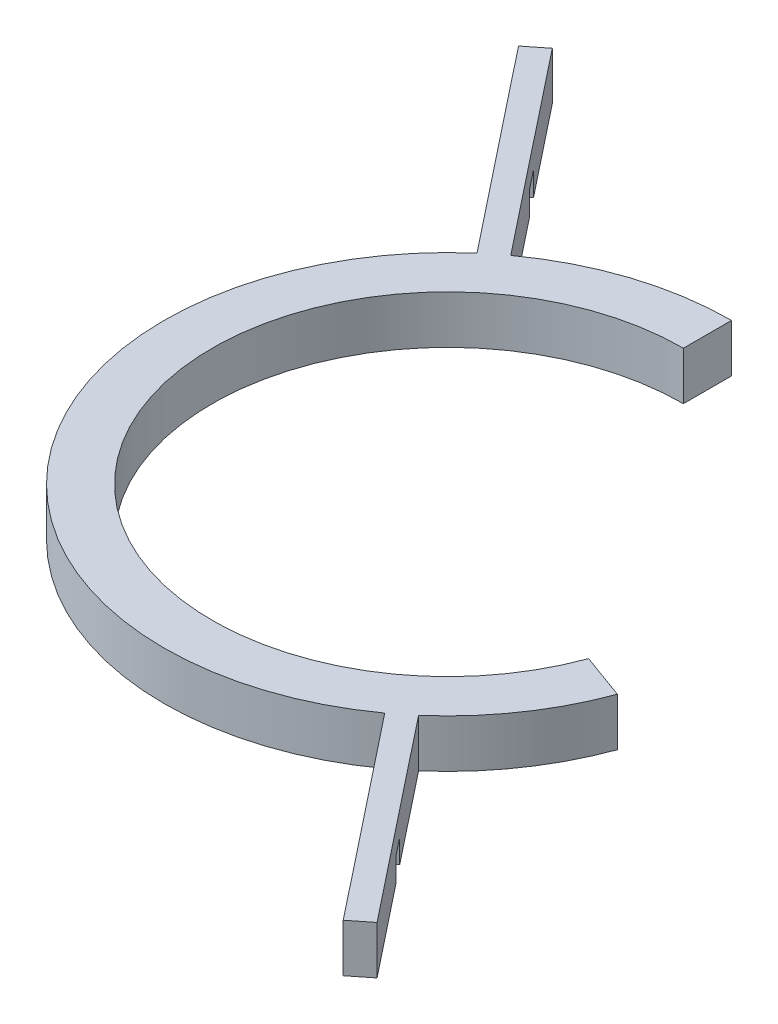
from build123d import *

# Parameters (mm, degrees)
BOSS_EXTRUDE2_DEPTH = 1
SKETCH2_W           = 0.5
SKETCH2_H           = 0.5
CUT_EXTRUDE2_DEPTH  = 1


with BuildPart() as part:
    # Sketch1 → Boss-Extrude2 (new body)
    with BuildSketch(Plane(origin=(0, 0, 0), x_dir=(1, 0, 0), z_dir=(0, 1, 0))):
        with BuildLine():
            Line((0, 4.9), (0, 5.9))
            ThreePointArc((0, 5.9), (-1.821669195, 5.611730691), (-3.465327772, 4.775091981))
            Line((-3.465327772, 4.775091981), (-6.763794049, 8.93713128))
            Line((-6.763794049, 8.93713128), (-7.155655692, 8.626576208))
            Line((-7.155655692, 8.626576208), (-3.857189415, 4.464536909))
            ThreePointArc((-3.857189415, 4.464536909), (-4.623967387, -3.66454985), (3.465327772, -4.775091981))
            Line((3.465327772, -4.775091981), (6.763794049, -8.93713128))
            Line((6.763794049, -8.93713128), (7.155655692, -8.626576208))
            Line((7.155655692, -8.626576208), (3.857189415, -4.464536909))
            ThreePointArc((3.857189415, -4.464536909), (4.857257671, -3.349186157), (5.544186463, -2.017918846))
            Line((5.544186463, -2.017918846), (4.604493842, -1.675898702))
            ThreePointArc((4.604493842, -1.675898702), (-4.013845017, -2.810524538), (0, 4.9))
        make_face()
    extrude(amount=BOSS_EXTRUDE2_DEPTH)

    # Sketch2 → Cut-Extrude2 (cut)
    with BuildSketch(Plane(origin=(-0.195930821, 0, 0.155277536), x_dir=(0.6211101441027557, 0, 0.7837232859196248), z_dir=(-0.7837232859196248, 0, 0.6211101441027557))):
        with Locations((8.55, 0.25)):
            Rectangle(SKETCH2_W, SKETCH2_H)
        with Locations((-8.55, 0.25)):
            Rectangle(SKETCH2_W, SKETCH2_H)
    extrude(amount=-CUT_EXTRUDE2_DEPTH, mode=Mode.SUBTRACT)


solid = part.part
